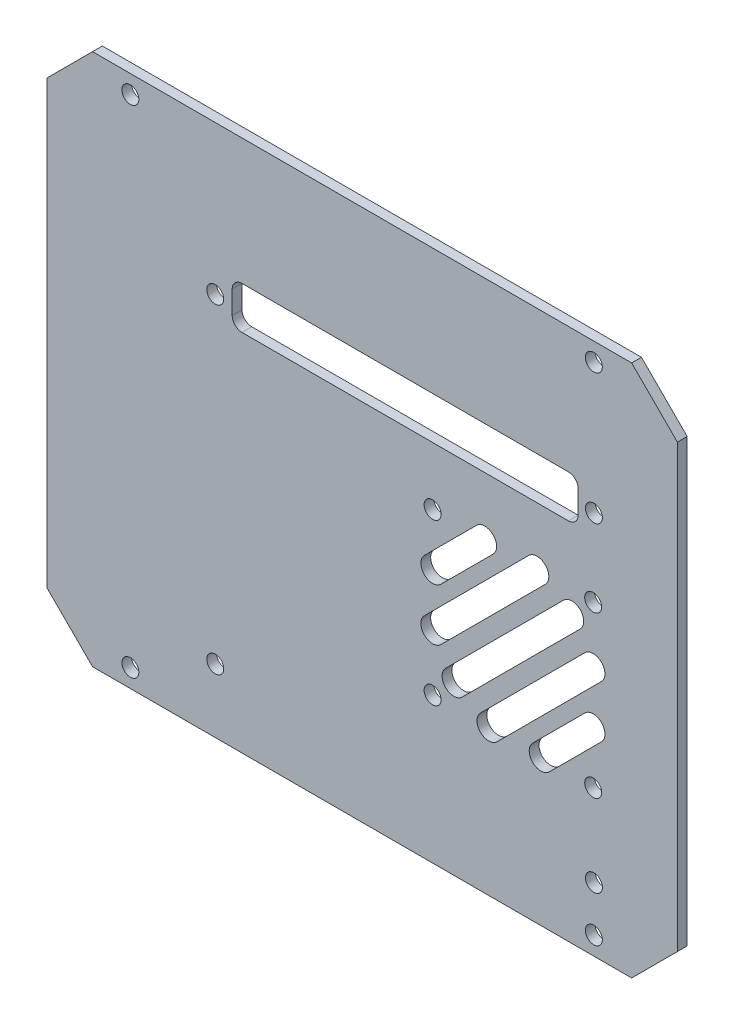
from build123d import *

# Parameters (mm, degrees)
EXTRUDE_1_DEPTH     = 1.5
SKETCH_3_R          = 1.3
CUT_EXTRUDE_1_DEPTH = 65.139634718
CUT_EXTRUDE_2_REACH = 66.14
SKETCH_4_R          = 1.3
CUT_EXTRUDE_3_REACH = 66.14
SKETCH_5_W          = 53
SKETCH_5_H          = 6.5
FILLET_1_R          = 1.5
CUT_EXTRUDE_4_REACH = 66.14
SKETCH_7_R          = 1.3
CUT_EXTRUDE_5_REACH = 66.14


with BuildPart() as part:
    # 草图2 → 凸台-拉伸1 (new body)
    with BuildSketch(Plane(origin=(0, 0, -39.19), x_dir=(-1, 0, 0), z_dir=(0, 0, -1))):
        Polygon((-47.34673203, -34.053824425), (-40.342568974, -41.057987481), (42.249104914, -41.057987481), (49.25326797, -34.053824425), (49.25326797, 33.537849463), (42.249104914, 40.542012519), (-40.342568974, 40.542012519), (-47.34673203, 33.537849463), align=None)
    extrude(amount=EXTRUDE_1_DEPTH)

    # 草图3 → 切除-拉伸1 (cut, through all)
    with BuildSketch(Plane(origin=(0, 0, -40.69), x_dir=(-1, 0, 0), z_dir=(0, 0, -1))):
        with Locations((-34.54673203, -38.257987481)):
            Circle(SKETCH_3_R)
        with Locations((36.45326797, -38.257987481)):
            Circle(SKETCH_3_R)
        with Locations((-34.54673203, 37.742012519)):
            Circle(SKETCH_3_R)
        with Locations((36.45326797, 37.742012519)):
            Circle(SKETCH_3_R)
    extrude(amount=-CUT_EXTRUDE_1_DEPTH, mode=Mode.SUBTRACT)

    # 草图4 → 切除-拉伸2 (cut, up to next)
    with BuildSketch(Plane(origin=(0, 0, -40.69), x_dir=(-1, 0, 0), z_dir=(0, 0, -1)), mode=Mode.PRIVATE) as cut_extrude_2_sk1:
        with Locations((23.45326797, -31.293200074)):
            Circle(SKETCH_4_R)
    cut_extrude_2_tool1 = extrude(cut_extrude_2_sk1.sketch, amount=-CUT_EXTRUDE_2_REACH, mode=Mode.PRIVATE) & part.part
    # 草图4 → 切除-拉伸2 (cut, up to next)
    with BuildSketch(Plane(origin=(0, 0, -40.69), x_dir=(-1, 0, 0), z_dir=(0, 0, -1)), mode=Mode.PRIVATE) as cut_extrude_2_sk2:
        with Locations((-34.558299802, -31.293200074)):
            Circle(SKETCH_4_R)
    cut_extrude_2_tool2 = extrude(cut_extrude_2_sk2.sketch, amount=-CUT_EXTRUDE_2_REACH, mode=Mode.PRIVATE) & part.part
    # 草图4 → 切除-拉伸2 (cut, up to next)
    with BuildSketch(Plane(origin=(0, 0, -40.69), x_dir=(-1, 0, 0), z_dir=(0, 0, -1)), mode=Mode.PRIVATE) as cut_extrude_2_sk3:
        with Locations((23.45326797, 17.742012519)):
            Circle(SKETCH_4_R)
    cut_extrude_2_tool3 = extrude(cut_extrude_2_sk3.sketch, amount=-CUT_EXTRUDE_2_REACH, mode=Mode.PRIVATE) & part.part
    # 草图4 → 切除-拉伸2 (cut, up to next)
    with BuildSketch(Plane(origin=(0, 0, -40.69), x_dir=(-1, 0, 0), z_dir=(0, 0, -1)), mode=Mode.PRIVATE) as cut_extrude_2_sk4:
        with Locations((-34.558299802, 17.742012519)):
            Circle(SKETCH_4_R)
    cut_extrude_2_tool4 = extrude(cut_extrude_2_sk4.sketch, amount=-CUT_EXTRUDE_2_REACH, mode=Mode.PRIVATE) & part.part
    add(cut_extrude_2_tool1.solids().sort_by_distance((-23.453268, -31.2932, -40.69))[0], mode=Mode.SUBTRACT)
    add(cut_extrude_2_tool2.solids().sort_by_distance((34.5583, -31.2932, -40.69))[0], mode=Mode.SUBTRACT)
    add(cut_extrude_2_tool3.solids().sort_by_distance((-23.453268, 17.742013, -40.69))[0], mode=Mode.SUBTRACT)
    add(cut_extrude_2_tool4.solids().sort_by_distance((34.5583, 17.742013, -40.69))[0], mode=Mode.SUBTRACT)

    # 草图5 → 切除-拉伸3 (cut, up to next)
    with BuildSketch(Plane(origin=(0, 0, -40.69), x_dir=(-1, 0, 0), z_dir=(0, 0, -1)), mode=Mode.PRIVATE) as cut_extrude_3_sk1:
        with Locations((-5.64673203, 17.992012519)):
            Rectangle(SKETCH_5_W, SKETCH_5_H)
    cut_extrude_3_tool1 = extrude(cut_extrude_3_sk1.sketch, amount=-CUT_EXTRUDE_3_REACH, mode=Mode.PRIVATE) & part.part
    add(cut_extrude_3_tool1.solids().sort_by_distance((5.646732, 17.992013, -40.69))[0], mode=Mode.SUBTRACT)

    # 圆角1
    fillet_1_edges = [part.edges().sort_by_distance(p)[0] for p in [
        (32.14673203, 21.242012519, -39.94),
        (32.14673203, 14.742012519, -39.94),
        (-20.85326797, 14.742012519, -39.94),
        (-20.85326797, 21.242012519, -39.94),
    ]]
    fillet(fillet_1_edges, radius=FILLET_1_R)

    # 草图7 → 切除-拉伸4 (cut, up to next)
    with BuildSketch(Plane(origin=(0, 0, -40.69), x_dir=(-1, 0, 0), z_dir=(0, 0, -1)), mode=Mode.PRIVATE) as cut_extrude_4_sk1:
        with Locations((-34.44673203, 5.842012519)):
            Circle(SKETCH_7_R)
    cut_extrude_4_tool1 = extrude(cut_extrude_4_sk1.sketch, amount=-CUT_EXTRUDE_4_REACH, mode=Mode.PRIVATE) & part.part
    # 草图7 → 切除-拉伸4 (cut, up to next)
    with BuildSketch(Plane(origin=(0, 0, -40.69), x_dir=(-1, 0, 0), z_dir=(0, 0, -1)), mode=Mode.PRIVATE) as cut_extrude_4_sk2:
        with Locations((-34.44673203, -18.757987481)):
            Circle(SKETCH_7_R)
    cut_extrude_4_tool2 = extrude(cut_extrude_4_sk2.sketch, amount=-CUT_EXTRUDE_4_REACH, mode=Mode.PRIVATE) & part.part
    # 草图7 → 切除-拉伸4 (cut, up to next)
    with BuildSketch(Plane(origin=(0, 0, -40.69), x_dir=(-1, 0, 0), z_dir=(0, 0, -1)), mode=Mode.PRIVATE) as cut_extrude_4_sk3:
        with Locations((-9.84673203, 5.842012519)):
            Circle(SKETCH_7_R)
    cut_extrude_4_tool3 = extrude(cut_extrude_4_sk3.sketch, amount=-CUT_EXTRUDE_4_REACH, mode=Mode.PRIVATE) & part.part
    # 草图7 → 切除-拉伸4 (cut, up to next)
    with BuildSketch(Plane(origin=(0, 0, -40.69), x_dir=(-1, 0, 0), z_dir=(0, 0, -1)), mode=Mode.PRIVATE) as cut_extrude_4_sk4:
        with Locations((-9.84673203, -18.757987481)):
            Circle(SKETCH_7_R)
    cut_extrude_4_tool4 = extrude(cut_extrude_4_sk4.sketch, amount=-CUT_EXTRUDE_4_REACH, mode=Mode.PRIVATE) & part.part
    add(cut_extrude_4_tool1.solids().sort_by_distance((34.446732, 5.842013, -40.69))[0], mode=Mode.SUBTRACT)
    add(cut_extrude_4_tool2.solids().sort_by_distance((34.446732, -18.757987, -40.69))[0], mode=Mode.SUBTRACT)
    add(cut_extrude_4_tool3.solids().sort_by_distance((9.846732, 5.842013, -40.69))[0], mode=Mode.SUBTRACT)
    add(cut_extrude_4_tool4.solids().sort_by_distance((9.846732, -18.757987, -40.69))[0], mode=Mode.SUBTRACT)

    # 草图8 → 切除-拉伸5 (cut, up to next)
    with BuildSketch(Plane(origin=(0, 0, -40.69), x_dir=(-1, 0, 0), z_dir=(0, 0, -1)), mode=Mode.PRIVATE) as cut_extrude_5_sk1:
        with BuildLine():
            Line((-29.92124863, 3.862113532), (-11.826631017, -14.232504081))
            ThreePointArc((-11.826631017, -14.232504081), (-11.826631017, -16.778088493), (-14.372215429, -16.778088493))
            Line((-14.372215429, -16.778088493), (-32.466833042, 1.31652912))
            ThreePointArc((-32.466833042, 1.31652912), (-32.466833042, 3.862113532), (-29.92124863, 3.862113532))
        make_face()
    cut_extrude_5_tool1 = extrude(cut_extrude_5_sk1.sketch, amount=-CUT_EXTRUDE_5_REACH, mode=Mode.PRIVATE) & part.part
    # 草图8 → 切除-拉伸5 (cut, up to next)
    with BuildSketch(Plane(origin=(0, 0, -40.69), x_dir=(-1, 0, 0), z_dir=(0, 0, -1)), mode=Mode.PRIVATE) as cut_extrude_5_sk2:
        with BuildLine():
            Line((-33.173939824, -1.485195275), (-17.173939824, -17.485195275))
            ThreePointArc((-17.173939824, -17.485195275), (-17.173939824, -20.030779687), (-19.719524236, -20.030779687))
            Line((-19.719524236, -20.030779687), (-35.719524236, -4.030779687))
            ThreePointArc((-35.719524236, -4.030779687), (-35.719524236, -1.485195275), (-33.173939824, -1.485195275))
        make_face()
    cut_extrude_5_tool2 = extrude(cut_extrude_5_sk2.sketch, amount=-CUT_EXTRUDE_5_REACH, mode=Mode.PRIVATE) & part.part
    # 草图8 → 切除-拉伸5 (cut, up to next)
    with BuildSketch(Plane(origin=(0, 0, -40.69), x_dir=(-1, 0, 0), z_dir=(0, 0, -1)), mode=Mode.PRIVATE) as cut_extrude_5_sk3:
        with BuildLine():
            Line((-24.573939824, 7.114804725), (-8.573939824, -8.885195275))
            ThreePointArc((-8.573939824, -8.885195275), (-8.573939824, -11.430779687), (-11.119524236, -11.430779687))
            Line((-11.119524236, -11.430779687), (-27.119524236, 4.569220313))
            ThreePointArc((-27.119524236, 4.569220313), (-27.119524236, 7.114804725), (-24.573939824, 7.114804725))
        make_face()
    cut_extrude_5_tool3 = extrude(cut_extrude_5_sk3.sketch, amount=-CUT_EXTRUDE_5_REACH, mode=Mode.PRIVATE) & part.part
    # 草图8 → 切除-拉伸5 (cut, up to next)
    with BuildSketch(Plane(origin=(0, 0, -40.69), x_dir=(-1, 0, 0), z_dir=(0, 0, -1)), mode=Mode.PRIVATE) as cut_extrude_5_sk4:
        with BuildLine():
            Line((-16.573939824, 7.114804725), (-8.573939824, -0.885195275))
            ThreePointArc((-8.573939824, -0.885195275), (-8.573939824, -3.430779687), (-11.119524236, -3.430779687))
            Line((-11.119524236, -3.430779687), (-19.119524236, 4.569220313))
            ThreePointArc((-19.119524236, 4.569220313), (-19.119524236, 7.114804725), (-16.573939824, 7.114804725))
        make_face()
    cut_extrude_5_tool4 = extrude(cut_extrude_5_sk4.sketch, amount=-CUT_EXTRUDE_5_REACH, mode=Mode.PRIVATE) & part.part
    # 草图8 → 切除-拉伸5 (cut, up to next)
    with BuildSketch(Plane(origin=(0, 0, -40.69), x_dir=(-1, 0, 0), z_dir=(0, 0, -1)), mode=Mode.PRIVATE) as cut_extrude_5_sk5:
        with BuildLine():
            Line((-33.173939824, -9.485195275), (-25.173939824, -17.485195275))
            ThreePointArc((-25.173939824, -17.485195275), (-25.173939824, -20.030779687), (-27.719524236, -20.030779687))
            Line((-27.719524236, -20.030779687), (-35.719524236, -12.030779687))
            ThreePointArc((-35.719524236, -12.030779687), (-35.719524236, -9.485195275), (-33.173939824, -9.485195275))
        make_face()
    cut_extrude_5_tool5 = extrude(cut_extrude_5_sk5.sketch, amount=-CUT_EXTRUDE_5_REACH, mode=Mode.PRIVATE) & part.part
    add(cut_extrude_5_tool1.solids().sort_by_distance((22.146732, -6.457987, -40.69))[0], mode=Mode.SUBTRACT)
    add(cut_extrude_5_tool2.solids().sort_by_distance((26.446732, -10.757987, -40.69))[0], mode=Mode.SUBTRACT)
    add(cut_extrude_5_tool3.solids().sort_by_distance((17.846732, -2.157987, -40.69))[0], mode=Mode.SUBTRACT)
    add(cut_extrude_5_tool4.solids().sort_by_distance((13.846732, 1.842013, -40.69))[0], mode=Mode.SUBTRACT)
    add(cut_extrude_5_tool5.solids().sort_by_distance((30.446732, -14.757987, -40.69))[0], mode=Mode.SUBTRACT)


solid = part.part
